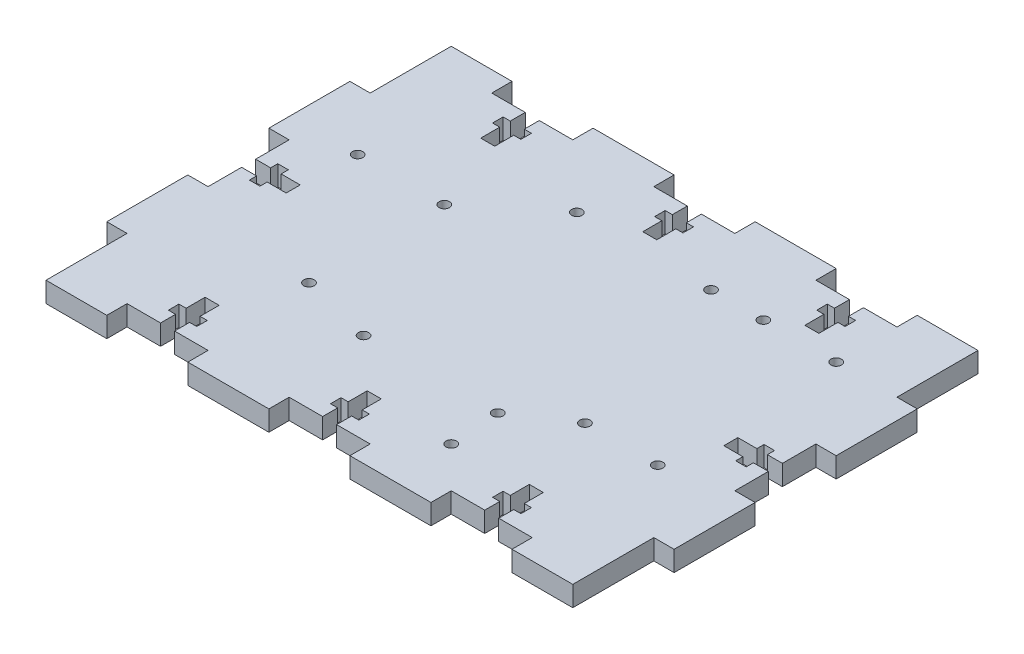
from build123d import *

# Parameters (mm, degrees)
SKETCH1_W                 = 177.8
SKETCH1_H                 = 127
BOSS_EXTRUDE1_DEPTH       = 6.35
SKETCH2_W                 = 6.35
SKETCH2_H                 = 25.4
CUT_EXTRUDE1_DEPTH        = 6.35
LPATTERN1_COUNT           = 3
LPATTERN1_PITCH           = 50.8
LPATTERN1_COUNT_DIR2      = 2
LPATTERN1_PITCH_DIR2      = 171.45
SKETCH3_W                 = 25.4
SKETCH3_H                 = 6.35
CUT_EXTRUDE2_DEPTH        = 6.35
LPATTERN2_COUNT           = 3
LPATTERN2_PITCH           = 50.8
LPATTERN2_COUNT_DIR2      = 2
LPATTERN2_PITCH_DIR2      = 120.65
SKETCH4_W                 = 13.97
SKETCH4_H                 = 4.3942
SKETCH4_W_2               = 3.302
SKETCH4_H_2               = 8.89
CUT_EXTRUDE3_DEPTH        = 8.89
SKETCH5_W                 = 4.3942
SKETCH5_H                 = 13.97
SKETCH5_W_2               = 8.89
SKETCH5_H_2               = 3.302
CUT_EXTRUDE4_DEPTH        = 30.48
LPATTERN3_COUNT           = 3
LPATTERN3_PITCH           = 50.8
MIRROR2_COPY_1_SKETCH_W   = 4.3942
MIRROR2_COPY_1_SKETCH_H   = 13.97
MIRROR2_COPY_1_SKETCH_W_2 = 8.89
MIRROR2_COPY_1_SKETCH_H_2 = 3.302
MIRROR2_COPY_1_DEPTH      = 30.48
MIRROR2_COPY_2_SKETCH_W   = 4.3942
MIRROR2_COPY_2_SKETCH_H   = 13.97
MIRROR2_COPY_2_SKETCH_W_2 = 8.89
MIRROR2_COPY_2_SKETCH_H_2 = 3.302
MIRROR2_COPY_2_DEPTH      = 30.48
MIRROR2_COPY_3_SKETCH_W   = 4.3942
MIRROR2_COPY_3_SKETCH_H   = 13.97
MIRROR2_COPY_3_SKETCH_W_2 = 8.89
MIRROR2_COPY_3_SKETCH_H_2 = 3.302
MIRROR2_COPY_3_DEPTH      = 30.48
F_4_CLEARANCE_HOLE2_D     = 3.2639
F_4_CLEARANCE_HOLE2_DEPTH = 10.16
F_4_CLEARANCE_HOLE2_TIP   = 0.980574487
F_4_CLEARANCE_HOLE3_D     = 3.2639
F_4_CLEARANCE_HOLE3_DEPTH = 10.16
F_4_CLEARANCE_HOLE3_TIP   = 0.980574487
F_4_CLEARANCE_HOLE4_D     = 3.2639
F_4_CLEARANCE_HOLE4_DEPTH = 10.16
F_4_CLEARANCE_HOLE4_TIP   = 0.980574487
F_4_CLEARANCE_HOLE5_D     = 3.2639
F_4_CLEARANCE_HOLE5_DEPTH = 10.16
F_4_CLEARANCE_HOLE5_TIP   = 0.980574487


with BuildPart() as part:
    # Sketch1 → Boss-Extrude1 (new body)
    with BuildSketch(Plane(origin=(0, 0, 0), x_dir=(1, 0, 0), z_dir=(0, 1, 0))):
        with Locations((88.9, 63.5)):
            Rectangle(SKETCH1_W, SKETCH1_H)
    extrude(amount=BOSS_EXTRUDE1_DEPTH)

    # Sketch2 → Cut-Extrude1 (cut)
    with BuildSketch(Plane(origin=(0, 6.35, 0), x_dir=(1, 0, 0), z_dir=(0, 1, 0))):
        with Locations((3.175, 114.3)):
            Rectangle(SKETCH2_W, SKETCH2_H)
    cut_extrude1 = extrude(amount=-CUT_EXTRUDE1_DEPTH, mode=Mode.SUBTRACT)

    # LPattern1: Cut-Extrude1 3 × 2
    with Locations(*[(j * LPATTERN1_PITCH_DIR2, 0, i * LPATTERN1_PITCH) for i in range(LPATTERN1_COUNT) for j in range(LPATTERN1_COUNT_DIR2) if (i, j) != (0, 0)]):
        add(cut_extrude1, mode=Mode.SUBTRACT)

    # Sketch3 → Cut-Extrude2 (cut)
    with BuildSketch(Plane(origin=(0, 6.35, 0), x_dir=(1, 0, 0), z_dir=(0, 1, 0))):
        with Locations((38.1, 3.175)):
            Rectangle(SKETCH3_W, SKETCH3_H)
    cut_extrude2 = extrude(amount=-CUT_EXTRUDE2_DEPTH, mode=Mode.SUBTRACT)

    # LPattern2: Cut-Extrude2 3 × 2
    with Locations(*[(i * LPATTERN2_PITCH, 0, -j * LPATTERN2_PITCH_DIR2) for i in range(LPATTERN2_COUNT) for j in range(LPATTERN2_COUNT_DIR2) if (i, j) != (0, 0)]):
        add(cut_extrude2, mode=Mode.SUBTRACT)

    # Sketch4 → Cut-Extrude3 (cut)
    with BuildSketch(Plane(origin=(0, 6.35, 0), x_dir=(1, 0, 0), z_dir=(0, 1, 0))):
        with Locations((164.465, 63.5)):
            Rectangle(SKETCH4_W, SKETCH4_H)
        with Locations((165.1, 63.5)):
            Rectangle(SKETCH4_W_2, SKETCH4_H_2)
    cut_extrude3 = extrude(amount=-CUT_EXTRUDE3_DEPTH, mode=Mode.SUBTRACT)

    # Mirror1: Cut-Extrude3 across plane
    add(cut_extrude3.mirror(Plane(origin=(88.9, 0, 0), x_dir=(0, 0, 1), z_dir=(1, 0, 0))), mode=Mode.SUBTRACT)

    # Sketch5 → Cut-Extrude4 (cut)
    with BuildSketch(Plane(origin=(0, 6.35, 0), x_dir=(1, 0, 0), z_dir=(0, 1, 0))):
        with Locations((38.1, 13.335)):
            Rectangle(SKETCH5_W, SKETCH5_H)
        with Locations((38.1, 12.7)):
            Rectangle(SKETCH5_W_2, SKETCH5_H_2)
    cut_extrude4 = extrude(amount=-CUT_EXTRUDE4_DEPTH, mode=Mode.SUBTRACT)

    # LPattern3: Cut-Extrude4 ×3
    with Locations(*[(i * LPATTERN3_PITCH, 0, 0) for i in range(1, LPATTERN3_COUNT)]):
        add(cut_extrude4, mode=Mode.SUBTRACT)

    # Mirror2 copy 1 sketch → Mirror2 copy 1 (cut)
    with BuildSketch(Plane(origin=(50.8, 6.35, -127), x_dir=(1, 0, 0), z_dir=(0, 1, 0))):
        with Locations((38.1, -13.335)):
            Rectangle(MIRROR2_COPY_1_SKETCH_W, MIRROR2_COPY_1_SKETCH_H)
        with Locations((38.1, -12.7)):
            Rectangle(MIRROR2_COPY_1_SKETCH_W_2, MIRROR2_COPY_1_SKETCH_H_2)
    extrude(amount=-MIRROR2_COPY_1_DEPTH, mode=Mode.SUBTRACT)

    # Mirror2 copy 2 sketch → Mirror2 copy 2 (cut)
    with BuildSketch(Plane(origin=(101.6, 6.35, -127), x_dir=(1, 0, 0), z_dir=(0, 1, 0))):
        with Locations((38.1, -13.335)):
            Rectangle(MIRROR2_COPY_2_SKETCH_W, MIRROR2_COPY_2_SKETCH_H)
        with Locations((38.1, -12.7)):
            Rectangle(MIRROR2_COPY_2_SKETCH_W_2, MIRROR2_COPY_2_SKETCH_H_2)
    extrude(amount=-MIRROR2_COPY_2_DEPTH, mode=Mode.SUBTRACT)

    # Mirror2 copy 3 sketch → Mirror2 copy 3 (cut)
    with BuildSketch(Plane(origin=(0, 6.35, -127), x_dir=(1, 0, 0), z_dir=(0, 1, 0))):
        with Locations((38.1, -13.335)):
            Rectangle(MIRROR2_COPY_3_SKETCH_W, MIRROR2_COPY_3_SKETCH_H)
        with Locations((38.1, -12.7)):
            Rectangle(MIRROR2_COPY_3_SKETCH_W_2, MIRROR2_COPY_3_SKETCH_H_2)
    extrude(amount=-MIRROR2_COPY_3_DEPTH, mode=Mode.SUBTRACT)

    # #4 Clearance Hole2
    with Locations(Plane(origin=(0, 6.35, 0), x_dir=(1, 0, 0), z_dir=(0, 1, 0))):
        with Locations((129.5908, 101.6), (152.4, 101.6), (152.4, 45.6692), (129.5908, 45.6692)):
            Hole(F_4_CLEARANCE_HOLE2_D / 2, depth=F_4_CLEARANCE_HOLE2_DEPTH)
            with Locations((0, 0, -(F_4_CLEARANCE_HOLE2_DEPTH + F_4_CLEARANCE_HOLE2_TIP / 2))):  # 118° drill point
                Cone(0, F_4_CLEARANCE_HOLE2_D / 2, F_4_CLEARANCE_HOLE2_TIP, mode=Mode.SUBTRACT)

    # #4 Clearance Hole3
    with Locations(Plane(origin=(0, 6.35, 0), x_dir=(1, 0, 0), z_dir=(0, 1, 0))):
        with Locations((21.082, 82.931), (48.26, 82.931), (48.26, 40.513)):
            Hole(F_4_CLEARANCE_HOLE3_D / 2, depth=F_4_CLEARANCE_HOLE3_DEPTH)
            with Locations((0, 0, -(F_4_CLEARANCE_HOLE3_DEPTH + F_4_CLEARANCE_HOLE3_TIP / 2))):  # 118° drill point
                Cone(0, F_4_CLEARANCE_HOLE3_D / 2, F_4_CLEARANCE_HOLE3_TIP, mode=Mode.SUBTRACT)

    # #4 Clearance Hole4
    with Locations(Plane(origin=(0, 6.35, 0), x_dir=(1, 0, 0), z_dir=(0, 1, 0))):
        with Locations((114.3, 19.05)):
            Hole(F_4_CLEARANCE_HOLE4_D / 2, depth=F_4_CLEARANCE_HOLE4_DEPTH)
            with Locations((0, 0, -(F_4_CLEARANCE_HOLE4_DEPTH + F_4_CLEARANCE_HOLE4_TIP / 2))):  # 118° drill point
                Cone(0, F_4_CLEARANCE_HOLE4_D / 2, F_4_CLEARANCE_HOLE4_TIP, mode=Mode.SUBTRACT)

    # #4 Clearance Hole5
    with Locations(Plane(origin=(0, 6.35, 0), x_dir=(1, 0, 0), z_dir=(0, 1, 0))):
        with Locations((71.12, 101.6), (113.1824, 101.6), (113.1824, 34.7472), (71.12, 34.7472)):
            Hole(F_4_CLEARANCE_HOLE5_D / 2, depth=F_4_CLEARANCE_HOLE5_DEPTH)
            with Locations((0, 0, -(F_4_CLEARANCE_HOLE5_DEPTH + F_4_CLEARANCE_HOLE5_TIP / 2))):  # 118° drill point
                Cone(0, F_4_CLEARANCE_HOLE5_D / 2, F_4_CLEARANCE_HOLE5_TIP, mode=Mode.SUBTRACT)


solid = part.part
